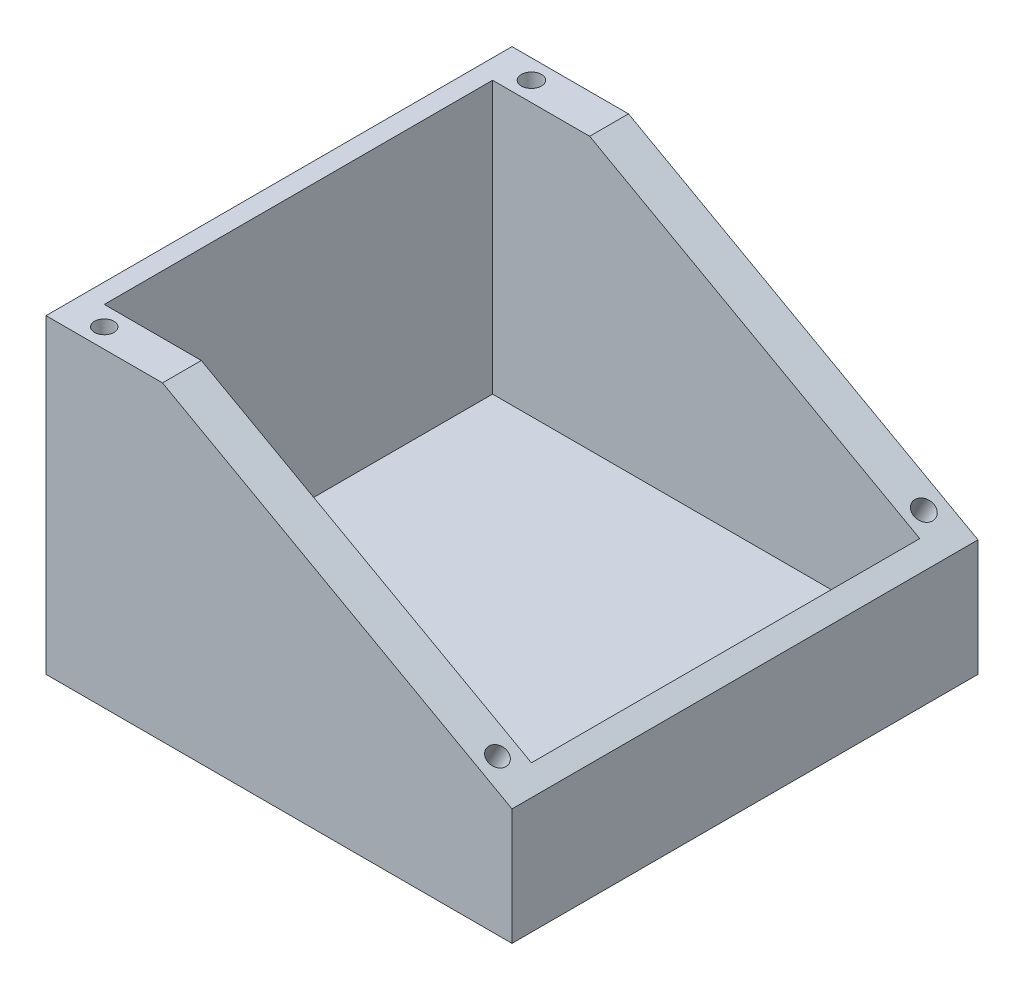
from build123d import *

# Parameters (mm, degrees)
SKETCH1_W           = 152.4
SKETCH1_H           = 101.6
BOSS_EXTRUDE1_DEPTH = 152.4
CUT_EXTRUDE2_DEPTH  = 152.4
SKETCH7_W           = 139.7
SKETCH7_H           = 127
CUT_EXTRUDE3_DEPTH  = 88.9
SKETCH8_R           = 3.175
SKETCH8_R_2         = 3.302
CUT_EXTRUDE4_DEPTH  = 12.7
SKETCH9_R           = 3.175
SKETCH9_R_2         = 3.302
CUT_EXTRUDE5_DEPTH  = 12.7


with BuildPart() as part:
    # Sketch1 → Boss-Extrude1 (new body)
    with BuildSketch(Plane.XY):
        with Locations((76.2, 50.8)):
            Rectangle(SKETCH1_W, SKETCH1_H)
    extrude(amount=BOSS_EXTRUDE1_DEPTH)

    # Sketch6 → Cut-Extrude2 (cut)
    with BuildSketch(Plane.XY.offset(152.4)):
        Polygon((104.436678767, 101.6), (38.1, 101.6), (152.4, 38.1), (152.4, 101.6), (104.590197544, 101.6), align=None)
    extrude(amount=-CUT_EXTRUDE2_DEPTH, mode=Mode.SUBTRACT)

    # Sketch7 → Cut-Extrude3 (cut)
    with BuildSketch(Plane(origin=(0, 101.6, 0), x_dir=(1, 0, 0), z_dir=(0, 1, 0))):
        with Locations((76.2, -76.2)):
            Rectangle(SKETCH7_W, SKETCH7_H)
    extrude(amount=-CUT_EXTRUDE3_DEPTH, mode=Mode.SUBTRACT)

    # Sketch8 → Cut-Extrude4 (cut)
    with BuildSketch(Plane(origin=(0, 101.6, 0), x_dir=(1, 0, 0), z_dir=(0, 1, 0))):
        with Locations((12.7, -146.05)):
            Circle(SKETCH8_R)
        with Locations((12.7, -6.35)):
            Circle(SKETCH8_R_2)
    extrude(amount=-CUT_EXTRUDE4_DEPTH, mode=Mode.SUBTRACT)

    # Sketch9 → Cut-Extrude5 (cut)
    with BuildSketch(Plane(origin=(52.117924528, 93.812264151, 0), x_dir=(0.8741572761215377, -0.4856429311786321, 0), z_dir=(0.4856429311786321, 0.8741572761215377, 0))):
        with Locations((102.018573203, -146.05)):
            Circle(SKETCH9_R)
        with Locations((102.018573203, -6.604)):
            Circle(SKETCH9_R_2)
    extrude(amount=-CUT_EXTRUDE5_DEPTH, mode=Mode.SUBTRACT)


solid = part.part
